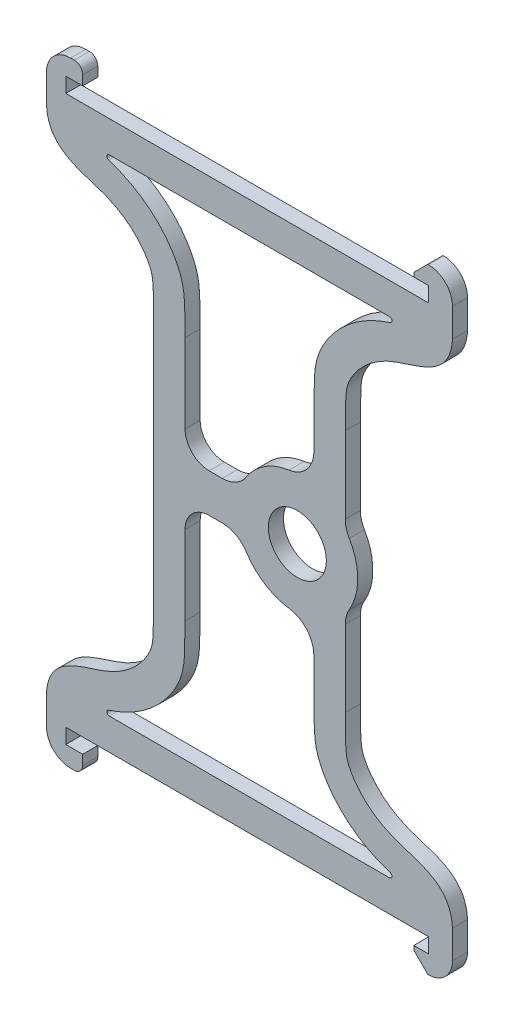
from build123d import *

# Parameters (mm, degrees)
SKETCH1_R           = 3.048
BOSS_EXTRUDE2_DEPTH = 1.5875
FILLET1_R           = 0.254


with BuildPart() as part:
    # Sketch1 → Boss-Extrude2 (new body)
    with BuildSketch(Plane.XY):
        with BuildLine():
            Line((-65.434017452, 53.6194), (-65.434017452, 56.5912))
            ThreePointArc((-65.434017452, 56.5912), (-64.690068676, 58.387251224), (-62.894017452, 59.1312))
            Line((-62.894017452, 59.1312), (-62.513017452, 59.1312))
            ThreePointArc((-62.513017452, 59.1312), (-61.884399523, 58.870817928), (-61.624017452, 58.2422))
            Line((-61.624017452, 58.2422), (-61.624017452, 57.2262))
            Line((-61.624017452, 57.2262), (-63.402017452, 57.2262))
            Line((-63.402017452, 57.2262), (-63.402017452, 55.6514))
            Line((-63.402017452, 55.6514), (-25.302017452, 55.6514))
            Line((-25.302017452, 55.6514), (-25.302017452, 57.2262))
            Line((-25.302017452, 57.2262), (-26.826017397, 57.225793732))
            Line((-26.826017397, 57.225793732), (-26.826132328, 57.656921208))
            Line((-26.826132328, 57.656921208), (-25.353325106, 59.130513882))
            Line((-25.353325106, 59.130513882), (-25.30252496, 59.130527424))
            ThreePointArc((-25.30252496, 59.130527424), (-23.506036033, 58.386818119), (-22.761847846, 56.590527515))
            Line((-22.761847846, 56.590527515), (-22.761847846, 53.6194))
            add(Edge.make_bspline(
                [(-22.761847846, 53.6194), (-22.966384985, 49.648429222), (-27.117872288, 49.418696243), (-31.827292238, 47.101597924), (-34.144816114, 44.067158287), (-33.977777083, 42.833714309), (-34.028382429, 39.645281186)],
                knots=[0, 0, 0, 0, 0.36456502, 0.416182118, 0.697050608, 1, 1, 1, 1], degree=3))
            Line((-34.028382429, 39.645281186), (-34.028382429, 31.59256633))
            ThreePointArc((-34.028382429, 31.59256633), (-33.920729589, 30.793871006), (-33.6054545, 30.052180389))
            ThreePointArc((-33.6054545, 30.052180389), (-32.7152, 26.8097), (-33.6054545, 23.567219611))
            ThreePointArc((-33.6054545, 23.567219611), (-33.920729589, 22.825528994), (-34.028382429, 22.02683367))
            Line((-34.028382429, 22.02683367), (-34.028382429, 13.974118814))
            add(Edge.make_bspline(
                [(-22.761847846, 0), (-22.966384985, 3.970970778), (-27.117872287, 4.200703757), (-31.827292238, 6.517802076), (-34.144816114, 9.552241713), (-33.977777083, 10.785685691), (-34.028382429, 13.974118814)],
                knots=[0, 0, 0, 0, 0.36456502, 0.416182118, 0.697050608, 1, 1, 1, 1], degree=3))
            Line((-22.761847846, 0), (-22.761847846, -2.971127515))
            ThreePointArc((-22.761847846, -2.971127515), (-23.506036033, -4.767418119), (-25.30252496, -5.511127424))
            Line((-25.30252496, -5.511127424), (-25.353325106, -5.511113882))
            Line((-25.353325106, -5.511113882), (-26.826132328, -4.037521208))
            Line((-26.826132328, -4.037521208), (-26.826017397, -3.606393732))
            Line((-26.826017397, -3.606393732), (-25.302017452, -3.6068))
            Line((-25.302017452, -3.6068), (-25.302017452, -2.032))
            Line((-25.302017452, -2.032), (-63.402017452, -2.032))
            Line((-63.402017452, -2.032), (-63.402017452, -3.6068))
            Line((-63.402017452, -3.6068), (-61.624017452, -3.6068))
            Line((-61.624017452, -3.6068), (-61.624017452, -4.6228))
            ThreePointArc((-61.624017452, -4.6228), (-61.884399523, -5.251417928), (-62.513017452, -5.5118))
            Line((-62.513017452, -5.5118), (-62.894017452, -5.5118))
            ThreePointArc((-62.894017452, -5.5118), (-64.690068676, -4.767851224), (-65.434017452, -2.9718))
            Line((-65.434017452, -2.9718), (-65.434017452, 0))
            add(Edge.make_bspline(
                [(-65.434017452, 0), (-65.229480312, 3.970970778), (-61.07799301, 4.200703757), (-56.368573059, 6.517802076), (-54.051049183, 9.552241713), (-54.218088214, 10.785685691), (-54.167482869, 13.974118814)],
                knots=[0, 0, 0, 0, 0.36456502, 0.416182118, 0.697050608, 1, 1, 1, 1], degree=3))
            Line((-54.167482869, 13.974118814), (-54.167482869, 39.645281186))
            add(Edge.make_bspline(
                [(-65.434017452, 53.6194), (-65.229480312, 49.648429222), (-61.07799301, 49.418696243), (-56.368573059, 47.101597924), (-54.051049183, 44.067158287), (-54.218088214, 42.833714309), (-54.167482869, 39.645281186)],
                knots=[0, 0, 0, 0, 0.36456502, 0.416182118, 0.697050608, 1, 1, 1, 1], degree=3))
        make_face()
        with Locations((-39.0652, 26.8097)):
            Circle(SKETCH1_R, mode=Mode.SUBTRACT)
        with BuildLine():
            Line((-60.420212319, 1.27), (-27.775652978, 1.27))
            add(Edge.make_bspline(
                [(-27.775652978, 1.27), (-27.93835212, 1.326211537), (-28.253184333, 1.430447395), (-28.980805052, 1.664906119), (-29.990691995, 1.994866082), (-31.341488075, 2.574963425), (-32.517235518, 3.252619827), (-33.554076518, 4.003903108), (-34.737693597, 5.066250813), (-35.640085537, 6.164824514), (-36.297936018, 7.228993659), (-36.681294184, 7.982254017), (-37.017021598, 8.898275238), (-37.2027884, 9.840047335), (-37.276187561, 10.706391524), (-37.302628422, 11.579516207), (-37.311662801, 12.430690515), (-37.320017115, 13.224194217), (-37.326374967, 13.695422998), (-37.329966611, 13.921717587)],
                knots=[0.254793571, 0.254793571, 0.254793571, 0.254793571, 0.278081272, 0.301368973, 0.347944374, 0.394519776, 0.441095178, 0.48767058, 0.534245982, 0.627396785, 0.673972187, 0.720547589, 0.767122991, 0.813698393, 0.860273795, 0.906849196, 0.953424598, 0.976712299, 1, 1, 1, 1], degree=3))
            Line((-37.329966611, 13.921717587), (-37.329966611, 17.531110954))
            ThreePointArc((-37.329966611, 17.531110954), (-38.07228934, 19.512934073), (-39.933923941, 20.519404402))
            ThreePointArc((-39.933923941, 20.519404402), (-42.488603208, 21.461540459), (-44.413829101, 23.387030466))
            ThreePointArc((-44.413829101, 23.387030466), (-45.506465964, 24.407291846), (-46.954770627, 24.7777))
            Line((-46.954770627, 24.7777), (-48.325898687, 24.7777))
            ThreePointArc((-48.325898687, 24.7777), (-50.121949911, 24.033751224), (-50.865898687, 22.2377))
            Line((-50.865898687, 22.2377), (-50.865898687, 13.921717587))
            add(Edge.make_bspline(
                [(-50.865898687, 13.921717587), (-50.86949033, 13.695422998), (-50.875848182, 13.224194217), (-50.884202496, 12.430690515), (-50.893236875, 11.579516207), (-50.919677736, 10.706391524), (-50.993076897, 9.840047335), (-51.178843699, 8.898275238), (-51.514571113, 7.982254017), (-51.897929279, 7.228993659), (-52.55577976, 6.164824514), (-53.4581717, 5.066250813), (-54.641788779, 4.003903108), (-55.678629779, 3.252619827), (-56.854377222, 2.574963425), (-58.205173302, 1.994866082), (-59.215060245, 1.664906119), (-59.942680964, 1.430447395), (-60.257513177, 1.326211537), (-60.420212319, 1.27)],
                knots=[0.254793571, 0.254793571, 0.254793571, 0.254793571, 0.278081272, 0.301368973, 0.347944374, 0.394519776, 0.441095178, 0.48767058, 0.534245982, 0.580821384, 0.627396785, 0.720547589, 0.767122991, 0.813698393, 0.860273795, 0.906849196, 0.953424598, 0.976712299, 1, 1, 1, 1], degree=3))
        make_face(mode=Mode.SUBTRACT)
        with BuildLine():
            Line((-60.420212319, 52.3494), (-27.775652978, 52.3494))
            add(Edge.make_bspline(
                [(-27.775652978, 52.3494), (-27.93835212, 52.293188463), (-28.253184333, 52.188952605), (-28.980805052, 51.954493881), (-29.990691995, 51.624533918), (-31.341488075, 51.044436575), (-32.517235518, 50.366780173), (-33.554076518, 49.615496892), (-34.737693597, 48.553149187), (-35.640085537, 47.454575486), (-36.297936018, 46.390406341), (-36.681294184, 45.637145983), (-37.017021598, 44.721124762), (-37.2027884, 43.779352665), (-37.276187561, 42.913008476), (-37.302628422, 42.039883793), (-37.311662801, 41.188709485), (-37.320017115, 40.395205783), (-37.326374967, 39.923977002), (-37.329966611, 39.697682413)],
                knots=[0.254793571, 0.254793571, 0.254793571, 0.254793571, 0.278081272, 0.301368973, 0.347944374, 0.394519776, 0.441095178, 0.48767058, 0.534245982, 0.627396785, 0.673972187, 0.720547589, 0.767122991, 0.813698393, 0.860273795, 0.906849196, 0.953424598, 0.976712299, 1, 1, 1, 1], degree=3))
            Line((-37.329966611, 39.697682413), (-37.329966611, 36.088289046))
            ThreePointArc((-37.329966611, 36.088289046), (-38.07228934, 34.106465927), (-39.933923941, 33.099995598))
            ThreePointArc((-39.933923941, 33.099995598), (-42.488603208, 32.157859541), (-44.413829101, 30.232369534))
            ThreePointArc((-44.413829101, 30.232369534), (-45.506465964, 29.212108154), (-46.954770627, 28.8417))
            Line((-46.954770627, 28.8417), (-48.325898687, 28.8417))
            ThreePointArc((-48.325898687, 28.8417), (-50.121949911, 29.585648776), (-50.865898687, 31.3817))
            Line((-50.865898687, 31.3817), (-50.865898687, 39.697682413))
            add(Edge.make_bspline(
                [(-50.865898687, 39.697682413), (-50.86949033, 39.923977002), (-50.875848182, 40.395205783), (-50.884202496, 41.188709485), (-50.893236875, 42.039883793), (-50.919677736, 42.913008476), (-50.993076897, 43.779352665), (-51.178843699, 44.721124762), (-51.514571113, 45.637145983), (-51.897929279, 46.390406341), (-52.55577976, 47.454575486), (-53.4581717, 48.553149187), (-54.641788779, 49.615496892), (-55.678629779, 50.366780173), (-56.854377222, 51.044436575), (-58.205173302, 51.624533918), (-59.215060245, 51.954493881), (-59.942680964, 52.188952605), (-60.257513177, 52.293188463), (-60.420212319, 52.3494)],
                knots=[0.254793571, 0.254793571, 0.254793571, 0.254793571, 0.278081272, 0.301368973, 0.347944374, 0.394519776, 0.441095178, 0.48767058, 0.534245982, 0.580821384, 0.627396785, 0.720547589, 0.767122991, 0.813698393, 0.860273795, 0.906849196, 0.953424598, 0.976712299, 1, 1, 1, 1], degree=3))
        make_face(mode=Mode.SUBTRACT)
    extrude(amount=BOSS_EXTRUDE2_DEPTH)

    # Fillet1
    fillet1_edges = [part.edges().sort_by_distance(p)[0] for p in [
        (-27.775652978, 1.27, 0.79375),
        (-60.420212319, 1.27, 0.79375),
        (-60.420212319, 52.3494, 0.79375),
        (-27.775652978, 52.3494, 0.79375),
    ]]
    fillet(fillet1_edges, radius=FILLET1_R)


solid = part.part
